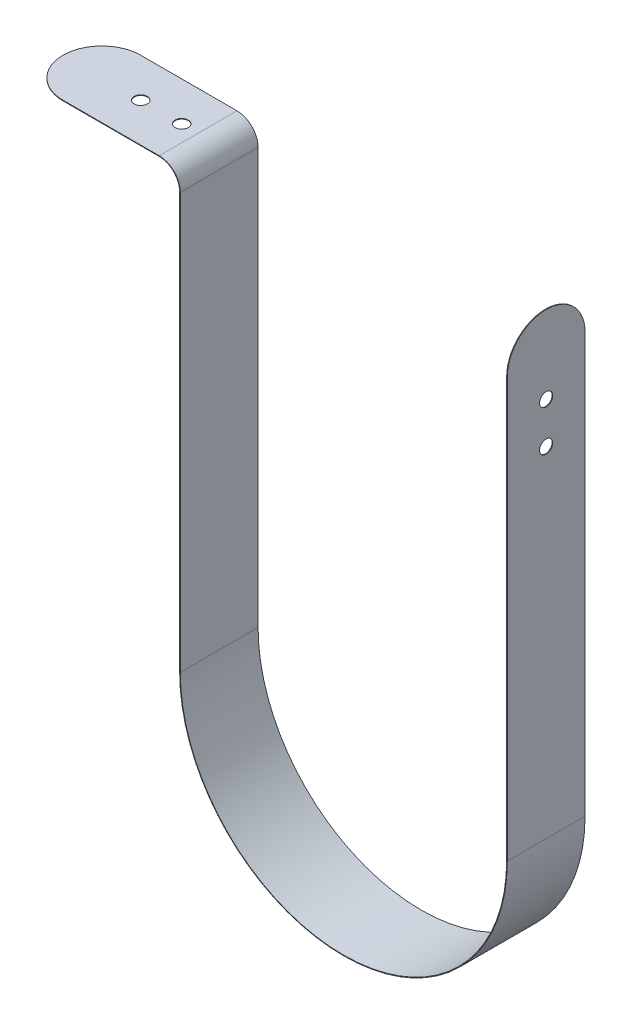
from build123d import *

# Parameters (mm, degrees)
SKETCH2_W            = 19
SKETCH2_H            = 0.15
M3_CLEARANCE_HOLE1_D = 3.2
CUT_EXTRUDE1_REACH   = 181.373
SKETCH5_R            = 1.6
MOVE_FACE1_BY        = 15
MOVE_FACE1_2_BY      = 15
FILLET1_R            = 9.5


with BuildPart() as part:
    # Sweep1: sweep along a path in tape_measure_path
    with BuildLine(Plane.XY) as sweep1_path:
        Line((0, 0), (18, 0))
        ThreePointArc((18, 0), (21.535533906, -1.464466094), (23, -5))
        Line((23, -5), (23, -106.544934808))
        ThreePointArc((23, -106.544934808), (63, -146.544934808), (103, -106.544934808))
        Line((103, -106.544934808), (103, -9.607557393))
    # Sketch2 → Sweep1 (sweep)
    with BuildSketch(Plane(origin=(0, 0, 0), x_dir=(0, 0, -1), z_dir=(1, 0, 0))):
        with Locations((0, 0.075)):
            Rectangle(SKETCH2_W, SKETCH2_H)
    sweep(path=sweep1_path.line)

    # M3 Clearance Hole1 (through all)
    with Locations(Plane(origin=(0, 0.15, 0), x_dir=(1, 0, 0), z_dir=(0, 1, 0))):
        with Locations((4, 0), (14, 0)):
            Hole(M3_CLEARANCE_HOLE1_D / 2)

    # Sketch5 → Cut-Extrude1 (cut, up to next)
    with BuildSketch(Plane(origin=(103, 0, 0), x_dir=(0, 0, -1), z_dir=(1, 0, 0)), mode=Mode.PRIVATE) as cut_extrude1_sk1:
        with Locations(Location((0, -13.607557393, 0), (0, 0, 90))):
            Circle(SKETCH5_R)
    cut_extrude1_tool1 = extrude(cut_extrude1_sk1.sketch, amount=-CUT_EXTRUDE1_REACH, mode=Mode.PRIVATE) & part.part
    # Sketch5 → Cut-Extrude1 (cut, up to next)
    with BuildSketch(Plane(origin=(103, 0, 0), x_dir=(0, 0, -1), z_dir=(1, 0, 0)), mode=Mode.PRIVATE) as cut_extrude1_sk2:
        with Locations(Location((0, -23.607557393, 0), (0, 0, 90))):
            Circle(SKETCH5_R)
    cut_extrude1_tool2 = extrude(cut_extrude1_sk2.sketch, amount=-CUT_EXTRUDE1_REACH, mode=Mode.PRIVATE) & part.part
    add(cut_extrude1_tool1.solids().sort_by_distance((103, -13.607557, 0))[0], mode=Mode.SUBTRACT)
    add(cut_extrude1_tool2.solids().sort_by_distance((103, -23.607557, 0))[0], mode=Mode.SUBTRACT)

    # Move Face1: a face moved outward by 15.0
    extrude(part.faces().sort_by_distance((102.925, -9.607557393, 0))[0], amount=MOVE_FACE1_BY, dir=(0, 1, 0))

    # Move Face1 2: a face moved outward by 15.0
    extrude(part.faces().sort_by_distance((0, 0.075, 0))[0], amount=MOVE_FACE1_2_BY, dir=(-1, 0, 0))

    # Fillet1
    fillet1_edges = [part.edges().sort_by_distance(p)[0] for p in [
        (-15, 0.075, 9.5),
        (-15, 0.075, -9.5),
        (102.925, 5.392442607, 9.5),
        (102.925, 5.392442607, -9.5),
    ]]
    fillet(fillet1_edges, radius=FILLET1_R - 0.0001)  # a hair under: the kernel refuses the full size


solid = part.part
